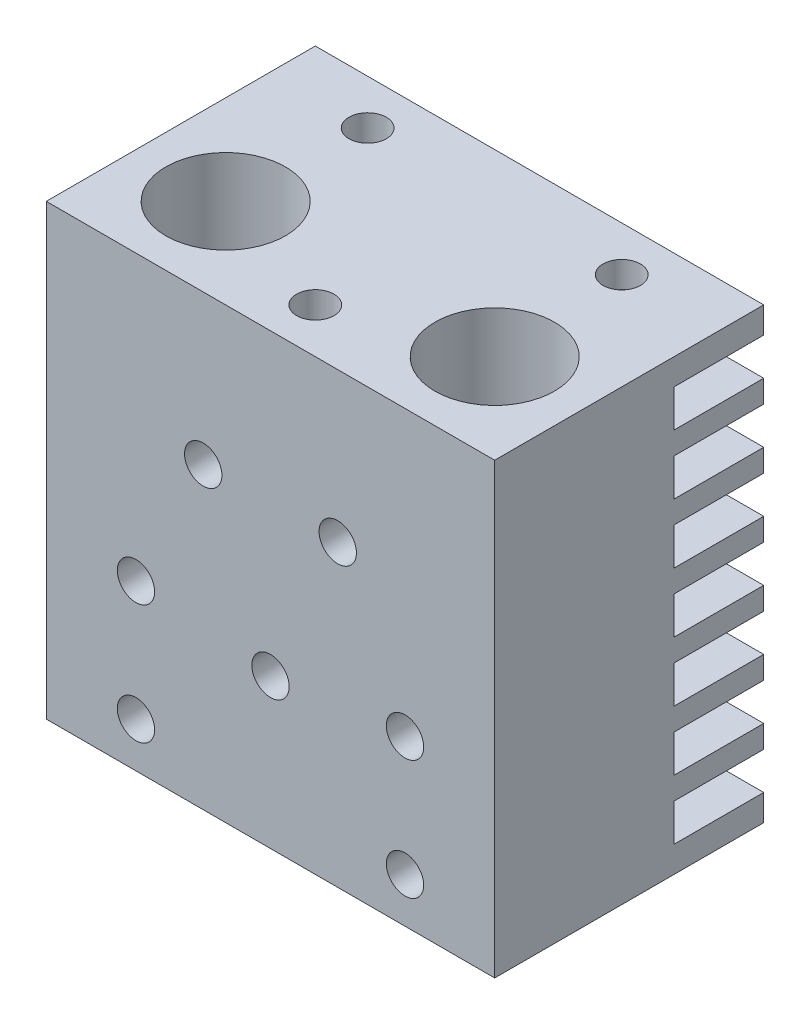
from build123d import *
from OCP.BRepFilletAPI import BRepFilletAPI_MakeChamfer

# Parameters (mm, degrees)
SKETCH1_W           = 30
SKETCH1_H           = 18
BOSS_EXTRUDE1_DEPTH = 30
SKETCH2_R           = 1.25
CUT_EXTRUDE1_DEPTH  = 8
SKETCH3_R           = 4
CUT_EXTRUDE2_DEPTH  = 6.5
SKETCH4_R           = 2.1
CUT_EXTRUDE3_DEPTH  = 30.295904151
CUT_EXTRUDE4_REACH  = 45.37
SKETCH5_W           = 12
SKETCH5_H           = 2.5
SKETCH6_R           = 3.45
CUT_EXTRUDE5_DEPTH  = 14
SKETCH7_R           = 1.25
CUT_EXTRUDE6_DEPTH  = 39.065732621
CHAMFER1_SIZE       = 1.7
CHAMFER1_SIZE2      = 0.65256886


with BuildPart() as part:
    # Sketch1 → Boss-Extrude1 (new body)
    with BuildSketch(Plane(origin=(0, 0, 0), x_dir=(1, 0, 0), z_dir=(0, 1, 0))):
        Rectangle(SKETCH1_W, SKETCH1_H)
    extrude(amount=BOSS_EXTRUDE1_DEPTH)

    # Sketch2 → Cut-Extrude1 (cut)
    with BuildSketch(Plane(origin=(0, 30, 0), x_dir=(1, 0, 0), z_dir=(0, 1, 0))):
        with Locations((0, -6)):
            Circle(SKETCH2_R)
        with Locations((-8.5, 6)):
            Circle(SKETCH2_R)
        with Locations((8.5, 6)):
            Circle(SKETCH2_R)
    extrude(amount=-CUT_EXTRUDE1_DEPTH, mode=Mode.SUBTRACT)

    # Sketch3 → Cut-Extrude2 (cut)
    with BuildSketch(Plane(origin=(0, 30, 0), x_dir=(1, 0, 0), z_dir=(0, 1, 0))):
        with Locations((-9, -3)):
            Circle(SKETCH3_R)
        with Locations((9, -3)):
            Circle(SKETCH3_R)
    extrude(amount=-CUT_EXTRUDE2_DEPTH, mode=Mode.SUBTRACT)

    # Sketch4 → Cut-Extrude3 (cut, through all)
    with BuildSketch(Plane(origin=(0, 23.5, 0), x_dir=(1, 0, 0), z_dir=(0, 1, 0))):
        with Locations((9, -3)):
            Circle(SKETCH4_R)
        with Locations((-9, -3)):
            Circle(SKETCH4_R)
    extrude(amount=-CUT_EXTRUDE3_DEPTH, mode=Mode.SUBTRACT)

    # Sketch5 → Cut-Extrude4 (cut, up to next)
    with BuildSketch(Plane(origin=(15, 0, 0), x_dir=(0, 0, -1), z_dir=(1, 0, 0)), mode=Mode.PRIVATE) as cut_extrude4_sk1:
        with Locations((9, 7)):
            Rectangle(SKETCH5_W, SKETCH5_H)
    cut_extrude4_tool1 = extrude(cut_extrude4_sk1.sketch, amount=-CUT_EXTRUDE4_REACH, mode=Mode.PRIVATE) & part.part
    # Sketch5 → Cut-Extrude4 (cut, up to next)
    with BuildSketch(Plane(origin=(15, 0, 0), x_dir=(0, 0, -1), z_dir=(1, 0, 0)), mode=Mode.PRIVATE) as cut_extrude4_sk2:
        with Locations((9, 11)):
            Rectangle(SKETCH5_W, SKETCH5_H)
    cut_extrude4_tool2 = extrude(cut_extrude4_sk2.sketch, amount=-CUT_EXTRUDE4_REACH, mode=Mode.PRIVATE) & part.part
    # Sketch5 → Cut-Extrude4 (cut, up to next)
    with BuildSketch(Plane(origin=(15, 0, 0), x_dir=(0, 0, -1), z_dir=(1, 0, 0)), mode=Mode.PRIVATE) as cut_extrude4_sk3:
        with Locations((9, 15)):
            Rectangle(SKETCH5_W, SKETCH5_H)
    cut_extrude4_tool3 = extrude(cut_extrude4_sk3.sketch, amount=-CUT_EXTRUDE4_REACH, mode=Mode.PRIVATE) & part.part
    # Sketch5 → Cut-Extrude4 (cut, up to next)
    with BuildSketch(Plane(origin=(15, 0, 0), x_dir=(0, 0, -1), z_dir=(1, 0, 0)), mode=Mode.PRIVATE) as cut_extrude4_sk4:
        with Locations((9, 19)):
            Rectangle(SKETCH5_W, SKETCH5_H)
    cut_extrude4_tool4 = extrude(cut_extrude4_sk4.sketch, amount=-CUT_EXTRUDE4_REACH, mode=Mode.PRIVATE) & part.part
    # Sketch5 → Cut-Extrude4 (cut, up to next)
    with BuildSketch(Plane(origin=(15, 0, 0), x_dir=(0, 0, -1), z_dir=(1, 0, 0)), mode=Mode.PRIVATE) as cut_extrude4_sk5:
        with Locations((9, 23)):
            Rectangle(SKETCH5_W, SKETCH5_H)
    cut_extrude4_tool5 = extrude(cut_extrude4_sk5.sketch, amount=-CUT_EXTRUDE4_REACH, mode=Mode.PRIVATE) & part.part
    # Sketch5 → Cut-Extrude4 (cut, up to next)
    with BuildSketch(Plane(origin=(15, 0, 0), x_dir=(0, 0, -1), z_dir=(1, 0, 0)), mode=Mode.PRIVATE) as cut_extrude4_sk6:
        with Locations((9, 27)):
            Rectangle(SKETCH5_W, SKETCH5_H)
    cut_extrude4_tool6 = extrude(cut_extrude4_sk6.sketch, amount=-CUT_EXTRUDE4_REACH, mode=Mode.PRIVATE) & part.part
    # Sketch5 → Cut-Extrude4 (cut, up to next)
    with BuildSketch(Plane(origin=(15, 0, 0), x_dir=(0, 0, -1), z_dir=(1, 0, 0)), mode=Mode.PRIVATE) as cut_extrude4_sk7:
        with Locations((9, 3)):
            Rectangle(SKETCH5_W, SKETCH5_H)
    cut_extrude4_tool7 = extrude(cut_extrude4_sk7.sketch, amount=-CUT_EXTRUDE4_REACH, mode=Mode.PRIVATE) & part.part
    add(cut_extrude4_tool1.solids().sort_by_distance((15, 7, -9))[0], mode=Mode.SUBTRACT)
    add(cut_extrude4_tool2.solids().sort_by_distance((15, 11, -9))[0], mode=Mode.SUBTRACT)
    add(cut_extrude4_tool3.solids().sort_by_distance((15, 15, -9))[0], mode=Mode.SUBTRACT)
    add(cut_extrude4_tool4.solids().sort_by_distance((15, 19, -9))[0], mode=Mode.SUBTRACT)
    add(cut_extrude4_tool5.solids().sort_by_distance((15, 23, -9))[0], mode=Mode.SUBTRACT)
    add(cut_extrude4_tool6.solids().sort_by_distance((15, 27, -9))[0], mode=Mode.SUBTRACT)
    add(cut_extrude4_tool7.solids().sort_by_distance((15, 3, -9))[0], mode=Mode.SUBTRACT)

    # Sketch6 → Cut-Extrude5 (cut)
    with BuildSketch(Plane.XZ):
        with Locations((9, 3)):
            Circle(SKETCH6_R)
        with Locations((-9, 3)):
            Circle(SKETCH6_R)
    extrude(amount=-CUT_EXTRUDE5_DEPTH, mode=Mode.SUBTRACT)

    # Sketch7 → Cut-Extrude6 (cut, through all)
    with BuildSketch(Plane.XY.offset(9)):
        with Locations((-4.5, 20)):
            Circle(SKETCH7_R)
        with Locations((4.5, 20)):
            Circle(SKETCH7_R)
        with Locations((-9, 11)):
            Circle(SKETCH7_R)
        with Locations((-9, 3)):
            Circle(SKETCH7_R)
        with Locations((9, 11)):
            Circle(SKETCH7_R)
        with Locations((9, 3)):
            Circle(SKETCH7_R)
        with Locations((0, 10)):
            Circle(SKETCH7_R)
    extrude(amount=-CUT_EXTRUDE6_DEPTH, mode=Mode.SUBTRACT)

    # Chamfer1: one chamfer whose edges measure the first distance from different faces: ONE call of the kernel's chamfer builder (chamfer() names one face for all edges)
    chamfer1_edges_1 = [part.edges().sort_by_distance(p)[0] for p in [
        (-11.1, 23.5, 3),
    ]]
    chamfer1_side_1 = [part.faces().sort_by_distance(p)[0] for p in [
        (-12.886862915, 23.5, 3),
    ]]
    chamfer1_edges_2 = [part.edges().sort_by_distance(p)[0] for p in [
        (6.9, 23.5, 3),
    ]]
    chamfer1_side_2 = [part.faces().sort_by_distance(p)[0] for p in [
        (5.113137085, 23.5, 3),
    ]]
    chamfer1 = BRepFilletAPI_MakeChamfer(part.part.solid().wrapped)
    for e in chamfer1_edges_1:
        chamfer1.Add(CHAMFER1_SIZE, CHAMFER1_SIZE2, e.wrapped, chamfer1_side_1[0].wrapped)  # the first distance lies on this face
    for e in chamfer1_edges_2:
        chamfer1.Add(CHAMFER1_SIZE, CHAMFER1_SIZE2, e.wrapped, chamfer1_side_2[0].wrapped)  # the first distance lies on this face
    add(Compound.cast(chamfer1.Shape()), mode=Mode.REPLACE)


solid = part.part
